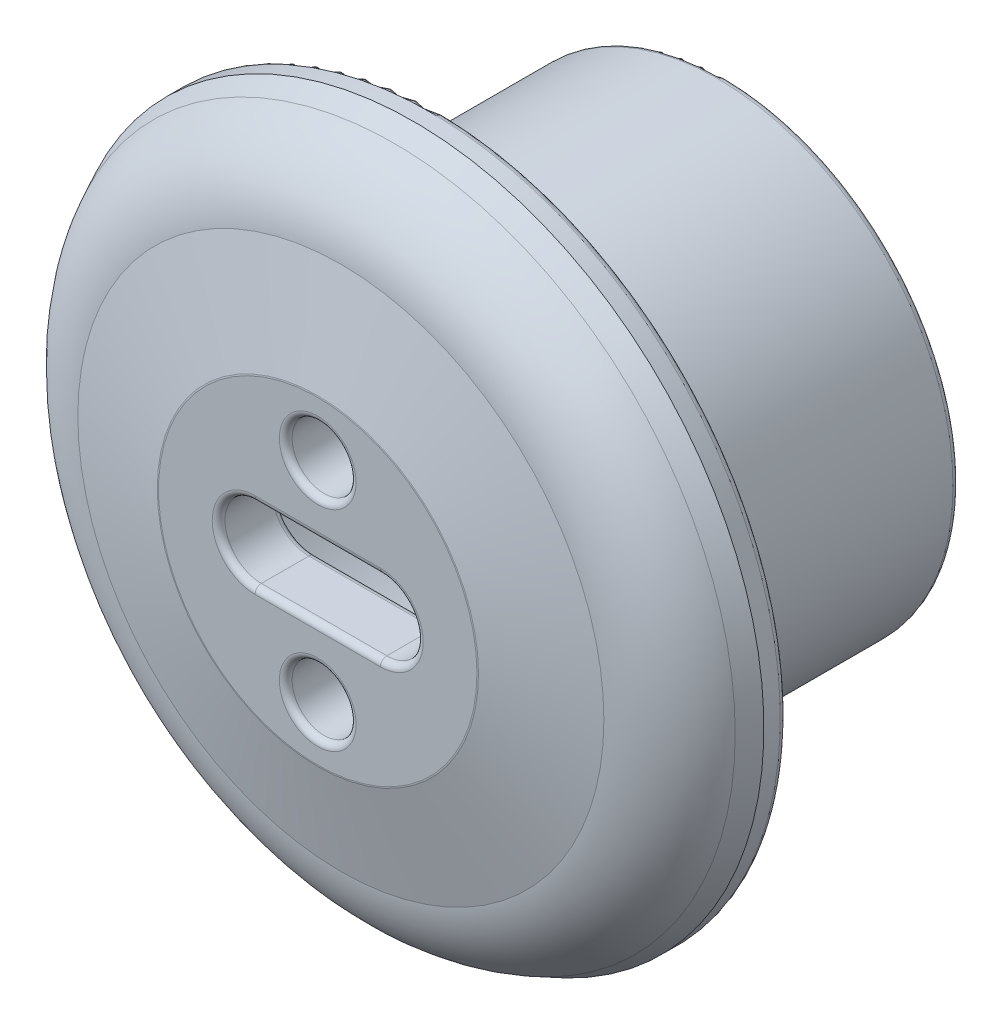
from build123d import *

# Parameters (mm, degrees)
FILLET2_R          = 0.2
SKETCH2_R          = 1
CUT_EXTRUDE1_DEPTH = 10
FILLET3_R          = 0.2


with BuildPart() as part:
    # Sketch1 → Revolve1 (revolve)
    with BuildSketch(Plane(origin=(0, 0, 0), x_dir=(0, 0, -1), z_dir=(1, 0, 0))):
        with BuildLine():
            Line((2.397152395, 10.655987944), (3, 10.95))
            Line((3, 10.95), (3.712206696, 10.95))
            Line((3.712206696, 10.95), (3.712206696, 8.9))
            Line((3.712206696, 8.9), (4.712206696, 8.9))
            Line((4.712206696, 8.9), (4.712206696, 7.35))
            Line((4.712206696, 7.35), (12.712206696, 7.35))
            Line((12.712206696, 7.35), (12.712206696, 6.35))
            Line((12.712206696, 6.35), (3.256669121, 6.35))
            Line((3.256669121, 6.35), (2.882509958, 6.35))
            ThreePointArc((2.882509958, 6.35), (2.175403177, 6.057106781), (1.882509958, 5.35))
            Line((1.882509958, 5.35), (1.882509958, 0))
            Line((1.882509958, 0), (0, 0))
            Line((0, 0), (0, 5))
            Line((0, 5), (0.723761069, 8.222622081))
            ThreePointArc((0.723761069, 8.222622081), (1.240295439, 9.659475411), (2.397152395, 10.655987944))
        make_face()
    revolve(axis=Axis((0, 0, -1.882509958), (0, 0, 1)))

    # Fillet2
    fillet2_edges = [part.edges().sort_by_distance(p)[0] for p in [
        (0, -6.35, -12.712206696),
        (0, -10.95, -3.712206696),
        (0, -8.9, -4.712206696),
        (0, -7.35, -12.712206696),
    ]]
    fillet(fillet2_edges, radius=FILLET2_R)

    # Sketch2 → Cut-Extrude1 (cut)
    with BuildSketch(Plane.XY):
        with Locations((0, 3.274424466)):
            Circle(SKETCH2_R)
        with Locations((0, -3.274424466)):
            Circle(SKETCH2_R)
        with BuildLine():
            Line((-1.959552245, 1.138245181), (1.959552245, 1.138245181))
            ThreePointArc((1.959552245, 1.138245181), (3.097797425, 0), (1.959552245, -1.138245181))
            Line((1.959552245, -1.138245181), (-1.959552245, -1.138245181))
            ThreePointArc((-1.959552245, -1.138245181), (-3.097797425, 0), (-1.959552245, 1.138245181))
        make_face()
    extrude(amount=-CUT_EXTRUDE1_DEPTH, mode=Mode.SUBTRACT)

    # Fillet3
    fillet3_edges = [part.edges().sort_by_distance(p)[0] for p in [
        (0, 1.138245181, -1.882509958),
        (3.097797425, 0, -1.882509958),
        (0, -1.138245181, -1.882509958),
        (-3.097797425, 0, -1.882509958),
        (-1, 3.274424466, -1.882509958),
        (-1, -3.274424466, -1.882509958),
        (0, -5, 0),
        (0, -1.138245181, 0),
        (3.097797425, 0, 0),
        (0, 1.138245181, 0),
        (-3.097797425, 0, 0),
        (-1, 3.274424466, 0),
        (-1, -3.274424466, 0),
    ]]
    fillet(fillet3_edges, radius=FILLET3_R)


solid = part.part
